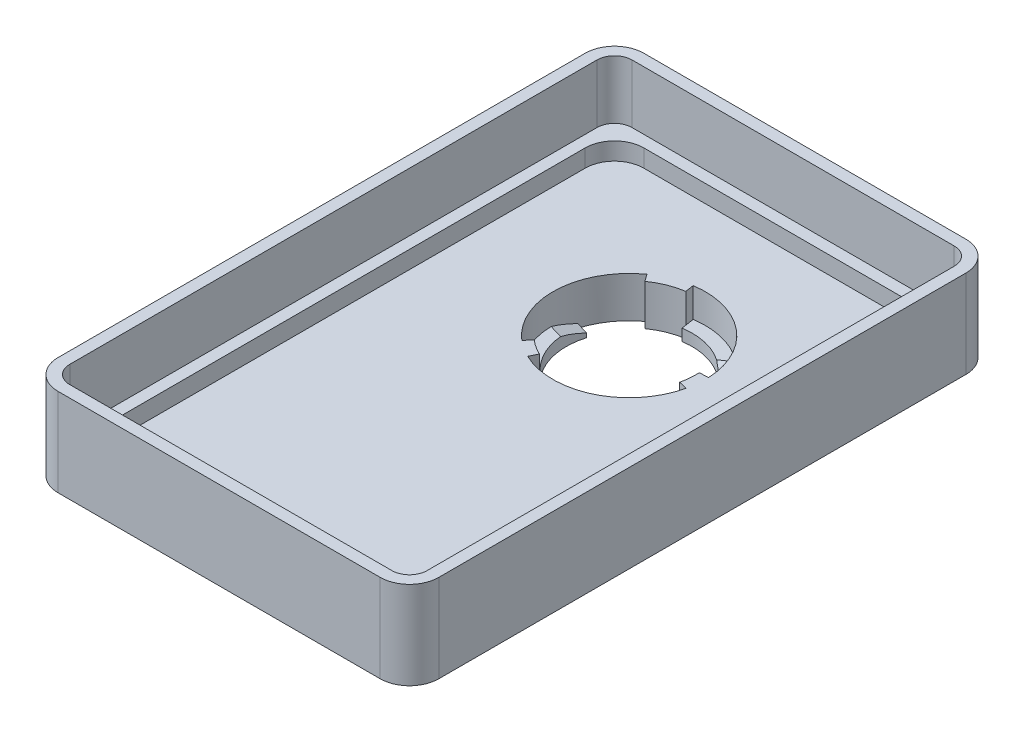
from build123d import *
from OCP.BRepFilletAPI import BRepFilletAPI_MakeChamfer

# Parameters (mm, degrees)
SKETCH1_W           = 65
SKETCH1_H           = 100
BOSS_EXTRUDE1_DEPTH = 2
SKETCH2_W           = 65
SKETCH2_H           = 100
SKETCH2_W_2         = 57
SKETCH2_H_2         = 92
BOSS_EXTRUDE2_DEPTH = 3
FILLET1_R           = 5
BOSS_EXTRUDE3_DEPTH = 10
SKETCH6_R           = 18
BOSS_EXTRUDE4_DEPTH = 5
CHAMFER1_SIZE       = 10
SKETCH7_R           = 13
CUT_EXTRUDE1_DEPTH  = 80.726093596
BOSS_EXTRUDE6_DEPTH = 2
BOSS_EXTRUDE7_DEPTH = 7
CHAMFER2_SIZE       = 1.3
CHAMFER2_SIZE2      = 4.000988598


with BuildPart() as part:
    # Sketch1 → Boss-Extrude1 (new body)
    with BuildSketch(Plane(origin=(0, 0, 0), x_dir=(1, 0, 0), z_dir=(0, 1, 0))):
        with Locations((0, -20)):
            Rectangle(SKETCH1_W, SKETCH1_H)
    extrude(amount=BOSS_EXTRUDE1_DEPTH)

    # Sketch2 → Boss-Extrude2 (add)
    with BuildSketch(Plane(origin=(0, 2, 0), x_dir=(1, 0, 0), z_dir=(0, 1, 0))):
        with Locations((0, -20)):
            Rectangle(SKETCH2_W, SKETCH2_H)
        with Locations((0, -20)):
            Rectangle(SKETCH2_W_2, SKETCH2_H_2, mode=Mode.SUBTRACT)
    extrude(amount=BOSS_EXTRUDE2_DEPTH)

    # Fillet1
    fillet1_edges = [part.edges().sort_by_distance(p)[0] for p in [
        (-28.5, 3.5, 66),
        (28.5, 3.5, 66),
        (28.5, 3.5, -26),
        (-28.5, 3.5, -26),
        (-32.5, 2.5, -30),
        (32.5, 2.5, -30),
        (32.5, 2.5, 70),
        (-32.5, 2.5, 70),
    ]]
    fillet(fillet1_edges, radius=FILLET1_R)

    # Sketch4 → Boss-Extrude3 (add)
    with BuildSketch(Plane(origin=(0, 5, 0), x_dir=(1, 0, 0), z_dir=(0, 1, 0))):
        with BuildLine():
            Line((-32.5, 25), (-32.5, -65))
            ThreePointArc((-32.5, -65), (-31.035533906, -68.535533906), (-27.5, -70))
            Line((-27.5, -70), (27.5, -70))
            ThreePointArc((27.5, -70), (31.035533906, -68.535533906), (32.5, -65))
            Line((32.5, -65), (32.5, 25))
            ThreePointArc((32.5, 25), (31.035533906, 28.535533906), (27.5, 30))
            Line((27.5, 30), (-27.5, 30))
            ThreePointArc((-27.5, 30), (-31.035533906, 28.535533906), (-32.5, 25))
        make_face()
        with BuildLine():
            Line((-30.5, 25), (-30.5, -65))
            ThreePointArc((-30.5, -65), (-29.621320344, -67.121320344), (-27.5, -68))
            Line((-27.5, -68), (27.5, -68))
            ThreePointArc((27.5, -68), (29.621320344, -67.121320344), (30.5, -65))
            Line((30.5, -65), (30.5, 25))
            ThreePointArc((30.5, 25), (29.621320344, 27.121320344), (27.5, 28))
            Line((27.5, 28), (-27.5, 28))
            ThreePointArc((-27.5, 28), (-29.621320344, 27.121320344), (-30.5, 25))
        make_face(mode=Mode.SUBTRACT)
    extrude(amount=BOSS_EXTRUDE3_DEPTH)

    # Sketch6 → Boss-Extrude4 (add)
    with BuildSketch(Plane(origin=(0, -5, 0), x_dir=(-1, 0, 0), z_dir=(0, -1, 0))):
        with Locations(Location((0, 0, 0), (0, 0, 90))):
            Circle(SKETCH6_R)
    extrude(amount=-BOSS_EXTRUDE4_DEPTH)

    # Chamfer1
    # the kernel refuses this chamfer: 10 mm, written as the material it adds along each edge
    with BuildSketch(Plane(origin=(0, 0, 0), x_dir=(0, 0, -1), z_dir=(-1, 0, 0))) as chamfer1_piece_1_section:
        Polygon((18 + CHAMFER1_SIZE, 0), (18, CHAMFER1_SIZE), (18, 0), align=None)
    chamfer1_piece_1 = revolve(axis=Axis((0, 0, 0), (0, -1, 0)), mode=Mode.PRIVATE)
    chamfer1_piece_1 = split(chamfer1_piece_1, bisect_by=Plane(origin=(0, -5, 25.515578953), z_dir=(0, 1, 0)), keep=Keep.TOP, mode=Mode.PRIVATE)
    add(chamfer1_piece_1)

    # Sketch7 → Cut-Extrude1 (cut, through all)
    with BuildSketch(Plane.XZ.offset(5)):
        with Locations(Location((0, 0, 0), (0, 0, 270))):
            Circle(SKETCH7_R)
    extrude(amount=-CUT_EXTRUDE1_DEPTH, mode=Mode.SUBTRACT)

    # Sketch8 → Boss-Extrude6 (add)
    with BuildSketch(Plane(origin=(0, -5, 0), x_dir=(-1, 0, 0), z_dir=(0, -1, 0))):
        with BuildLine():
            ThreePointArc((-9.53952181, 6.422423502), (-4.636164201, 10.524066776), (1.699808228, 11.373682429))
            Line((1.699808228, 11.373682429), (1.921522345, 12.857206224))
            ThreePointArc((1.921522345, 12.857206224), (-5.240881271, 11.896771138), (-10.783807263, 7.260130916))
            Line((-10.783807263, 7.260130916), (-9.53952181, 6.422423502))
        make_face()
        with BuildLine():
            Line((1.921522345, 12.857206224), (1.699808228, 11.373682429))
            ThreePointArc((1.699808228, 11.373682429), (4.307975824, 10.662614328), (6.678083991, 9.362328461))
            Line((6.678083991, 9.362328461), (7.549138424, 10.583501739))
            ThreePointArc((7.549138424, 10.583501739), (4.869885714, 12.053390109), (1.921522345, 12.857206224))
        make_face()
        with BuildLine():
            Line((12.464656553, 3.692199481), (11.026426951, 3.266176464))
            ThreePointArc((11.026426951, 3.266176464), (11.380990948, 1.650165153), (11.5, 0))
            ThreePointArc((11.5, 0), (10.443646499, -4.814586982), (7.468652556, -8.744668604))
            Line((7.468652556, -8.744668604), (8.442824628, -9.885277553))
            ThreePointArc((8.442824628, -9.885277553), (11.80586126, -5.442576588), (13, 0))
            ThreePointArc((13, 0), (12.865468029, 1.865404086), (12.464656553, 3.692199481))
        make_face()
        with BuildLine():
            ThreePointArc((7.468652556, -8.744668604), (6.263348903, -9.644711531), (4.950877613, -10.37973077))
            Line((4.950877613, -10.37973077), (5.596644259, -11.733608697))
            ThreePointArc((5.596644259, -11.733608697), (7.080307455, -10.902717383), (8.442824628, -9.885277553))
            Line((8.442824628, -9.885277553), (7.468652556, -8.744668604))
        make_face()
        with BuildLine():
            ThreePointArc((-8.917379083, 6.003569796), (-4.333805666, 9.837714595), (1.58895117, 10.631920531))
            Line((1.58895117, 10.631920531), (1.699808228, 11.373682429))
            ThreePointArc((1.699808228, 11.373682429), (-4.636164201, 10.524066776), (-9.53952181, 6.422423502))
            Line((-9.53952181, 6.422423502), (-8.917379083, 6.003569796))
        make_face()
        with BuildLine():
            Line((11.026426951, 3.266176464), (10.30731215, 3.053164956))
            ThreePointArc((10.30731215, 3.053164956), (10.638752408, 1.542545686), (10.75, 0))
            ThreePointArc((10.75, 0), (9.762539119, -4.500592179), (6.98156652, -8.17436413))
            Line((6.98156652, -8.17436413), (7.468652556, -8.744668604))
            ThreePointArc((7.468652556, -8.744668604), (10.443646499, -4.814586982), (11.5, 0))
            ThreePointArc((11.5, 0), (11.380990948, 1.650165153), (11.026426951, 3.266176464))
        make_face()
        with BuildLine():
            Line((-2.48051694, -12.761153385), (-2.194303447, -11.28871261))
            ThreePointArc((-2.194303447, -11.28871261), (-7.98857126, -8.272407704), (-11.205255745, -2.586937125))
            Line((-11.205255745, -2.586937125), (-12.666810842, -2.924363706))
            ThreePointArc((-12.666810842, -2.924363706), (-9.030558816, -9.351417404), (-2.48051694, -12.761153385))
        make_face()
        with BuildLine():
            Line((-2.194303447, -11.28871261), (-2.0511967, -10.552492222))
            ThreePointArc((-2.0511967, -10.552492222), (-7.467577482, -7.732902854), (-10.474478196, -2.418223834))
            Line((-10.474478196, -2.418223834), (-11.205255745, -2.586937125))
            ThreePointArc((-11.205255745, -2.586937125), (-7.98857126, -8.272407704), (-2.194303447, -11.28871261))
        make_face()
        with BuildLine():
            ThreePointArc((-11.205255745, -2.586937125), (-11.451756667, -1.052268615), (-11.489054548, 0.501622955))
            Line((-11.489054548, 0.501622955), (-12.987626881, 0.567052036))
            ThreePointArc((-12.987626881, 0.567052036), (-12.945464058, -1.189521043), (-12.666810842, -2.924363706))
            Line((-12.666810842, -2.924363706), (-11.205255745, -2.586937125))
        make_face()
    extrude(amount=-BOSS_EXTRUDE6_DEPTH)

    # Sketch8<5> → Boss-Extrude7 (add)
    with BuildSketch(Plane(origin=(0, -5, 0), x_dir=(-1, 0, 0), z_dir=(0, -1, 0))):
        with BuildLine():
            Line((1.921522345, 12.857206224), (1.699808228, 11.373682429))
            ThreePointArc((1.699808228, 11.373682429), (4.307975824, 10.662614328), (6.678083991, 9.362328461))
            Line((6.678083991, 9.362328461), (7.549138424, 10.583501739))
            ThreePointArc((7.549138424, 10.583501739), (4.869885714, 12.053390109), (1.921522345, 12.857206224))
        make_face()
        with BuildLine():
            ThreePointArc((7.468652556, -8.744668604), (6.263348903, -9.644711531), (4.950877613, -10.37973077))
            Line((4.950877613, -10.37973077), (5.596644259, -11.733608697))
            ThreePointArc((5.596644259, -11.733608697), (7.080307455, -10.902717383), (8.442824628, -9.885277553))
            Line((8.442824628, -9.885277553), (7.468652556, -8.744668604))
        make_face()
        with BuildLine():
            ThreePointArc((-11.205255745, -2.586937125), (-11.451756667, -1.052268615), (-11.489054548, 0.501622955))
            Line((-11.489054548, 0.501622955), (-12.987626881, 0.567052036))
            ThreePointArc((-12.987626881, 0.567052036), (-12.945464058, -1.189521043), (-12.666810842, -2.924363706))
            Line((-12.666810842, -2.924363706), (-11.205255745, -2.586937125))
        make_face()
    extrude(amount=-BOSS_EXTRUDE7_DEPTH)

    # Chamfer2: one chamfer whose edges measure the first distance from different faces: ONE call of the kernel's chamfer builder (chamfer() names one face for all edges)
    chamfer2_edges_1 = [part.edges().sort_by_distance(p)[0] for p in [
        (9.850593173, -3, -6.631850356),
    ]]
    chamfer2_side_1 = [part.faces().sort_by_distance(p)[0] for p in [
        (9.850593173, -4, -6.631850356),
    ]]
    chamfer2_edges_2 = [part.edges().sort_by_distance(p)[0] for p in [
        (-11.385984352, -3, -3.372682218),
    ]]
    chamfer2_side_2 = [part.faces().sort_by_distance(p)[0] for p in [
        (-11.385984352, -4, -3.372682218),
    ]]
    chamfer2_edges_3 = [part.edges().sort_by_distance(p)[0] for p in [
        (2.26585682, -3, 11.656822803),
    ]]
    chamfer2_side_3 = [part.faces().sort_by_distance(p)[0] for p in [
        (2.26585682, -4, 11.656822803),
    ]]
    chamfer2 = BRepFilletAPI_MakeChamfer(part.part.solid().wrapped)
    for e in chamfer2_edges_1:
        chamfer2.Add(CHAMFER2_SIZE, CHAMFER2_SIZE2, e.wrapped, chamfer2_side_1[0].wrapped)  # the first distance lies on this face
    for e in chamfer2_edges_2:
        chamfer2.Add(CHAMFER2_SIZE, CHAMFER2_SIZE2, e.wrapped, chamfer2_side_2[0].wrapped)  # the first distance lies on this face
    for e in chamfer2_edges_3:
        chamfer2.Add(CHAMFER2_SIZE, CHAMFER2_SIZE2, e.wrapped, chamfer2_side_3[0].wrapped)  # the first distance lies on this face
    add(Compound.cast(chamfer2.Shape()), mode=Mode.REPLACE)


solid = part.part
